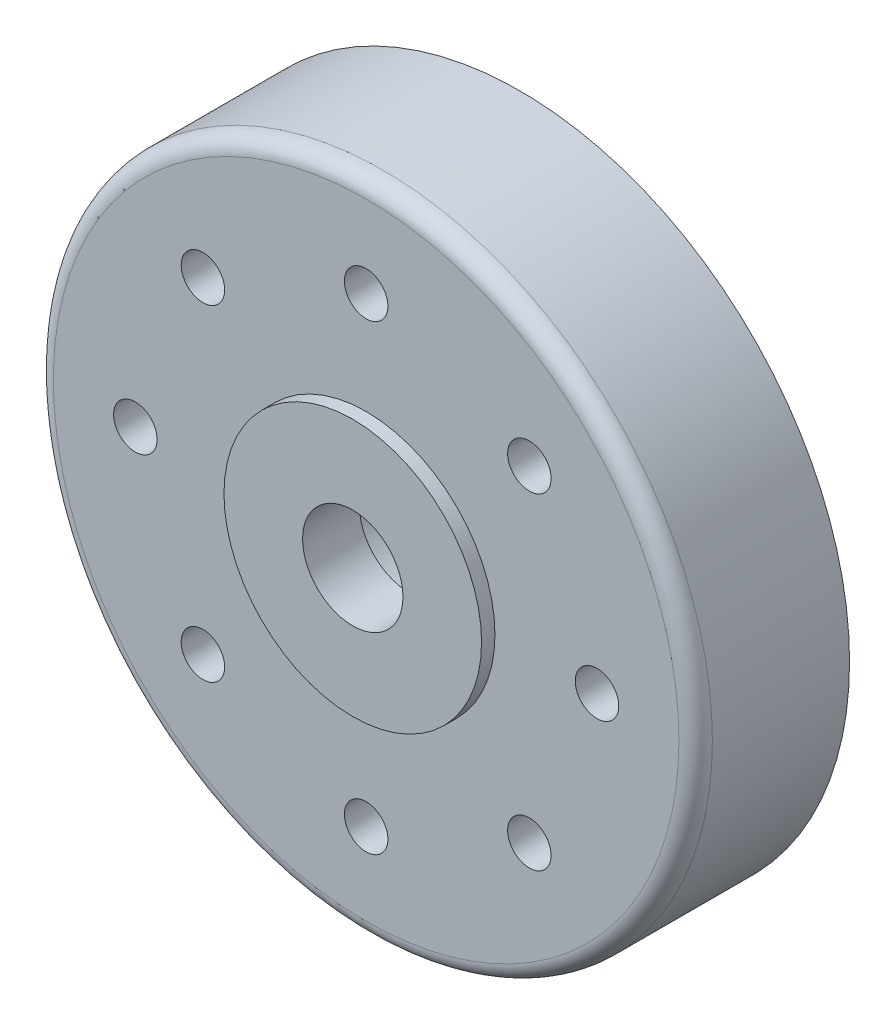
from build123d import *

# Parameters (mm, degrees)
SKETCH1_R           = 9.85
SKETCH1_R_2         = 1.5
SKETCH1_R_3         = 0.65
BOSS_EXTRUDE1_DEPTH = 5
SKETCH4_R           = 2.5
CUT_EXTRUDE2_DEPTH  = 3.3
SHELL1_OUTLINE_R    = 3.9
SHELL1_DEPTH        = 3.6
CUT_EXTRUDE1_START  = -0.4
SKETCH3_R           = 9.85
SKETCH3_R_2         = 3.85
CUT_EXTRUDE1_DEPTH  = 0.4
FILLET1_R           = 0.5


# Read off the part's stored shape, not the designer's step: Shell1
with BuildPart() as part:
    # Sketch1 → Boss-Extrude1 (new body)
    with BuildSketch(Plane.XY):
        Circle(SKETCH1_R)
        Circle(SKETCH1_R_2, mode=Mode.SUBTRACT)
        with Locations((0, 6.9)):
            Circle(SKETCH1_R_3, mode=Mode.SUBTRACT)
        with Locations((4.87903679, 4.87903679)):
            Circle(SKETCH1_R_3, mode=Mode.SUBTRACT)
        with Locations((6.9, 0)):
            Circle(SKETCH1_R_3, mode=Mode.SUBTRACT)
        with Locations((4.87903679, -4.87903679)):
            Circle(SKETCH1_R_3, mode=Mode.SUBTRACT)
        with Locations((0, -6.9)):
            Circle(SKETCH1_R_3, mode=Mode.SUBTRACT)
        with Locations((-4.87903679, -4.87903679)):
            Circle(SKETCH1_R_3, mode=Mode.SUBTRACT)
        with Locations((-6.9, 0)):
            Circle(SKETCH1_R_3, mode=Mode.SUBTRACT)
        with Locations((-4.87903679, 4.87903679)):
            Circle(SKETCH1_R_3, mode=Mode.SUBTRACT)
    extrude(amount=BOSS_EXTRUDE1_DEPTH)

    # Sketch4 → Cut-Extrude2 (cut)
    with BuildSketch(Plane(origin=(0, 0, 0), x_dir=(-1, 0, 0), z_dir=(0, 0, -1))):
        Circle(SKETCH4_R)
    extrude(amount=-CUT_EXTRUDE2_DEPTH, mode=Mode.SUBTRACT)

    # Shell1 outline → Shell1 (cut)
    with BuildSketch(Plane.XY):
        with BuildLine():
            ThreePointArc((4.837035489, 6.928606474), (3.233675004, 7.80678205), (1.478964027, 8.319565217))
            ThreePointArc((1.478964027, 8.319565217), (0, 4.85), (-1.478964027, 8.319565217))
            ThreePointArc((-1.478964027, 8.319565217), (-3.233675004, 7.80678205), (-4.837035489, 6.928606474))
            ThreePointArc((-4.837035489, 6.928606474), (-3.429467889, 3.429467889), (-6.928606474, 4.837035489))
            ThreePointArc((-6.928606474, 4.837035489), (-7.80678205, 3.233675004), (-8.319565217, 1.478964027))
            ThreePointArc((-8.319565217, 1.478964027), (-4.85, 0), (-8.319565217, -1.478964027))
            ThreePointArc((-8.319565217, -1.478964027), (-7.80678205, -3.233675004), (-6.928606474, -4.837035489))
            ThreePointArc((-6.928606474, -4.837035489), (-3.429467889, -3.429467889), (-4.837035489, -6.928606474))
            ThreePointArc((-4.837035489, -6.928606474), (-3.233675004, -7.80678205), (-1.478964027, -8.319565217))
            ThreePointArc((-1.478964027, -8.319565217), (0, -4.85), (1.478964027, -8.319565217))
            ThreePointArc((1.478964027, -8.319565217), (3.233675004, -7.80678205), (4.837035489, -6.928606474))
            ThreePointArc((4.837035489, -6.928606474), (3.429467889, -3.429467889), (6.928606474, -4.837035489))
            ThreePointArc((6.928606474, -4.837035489), (7.80678205, -3.233675004), (8.319565217, -1.478964027))
            ThreePointArc((8.319565217, -1.478964027), (4.85, 0), (8.319565217, 1.478964027))
            ThreePointArc((8.319565217, 1.478964027), (7.80678205, 3.233675004), (6.928606474, 4.837035489))
            ThreePointArc((6.928606474, 4.837035489), (3.429467889, 3.429467889), (4.837035489, 6.928606474))
        make_face()
        Circle(SHELL1_OUTLINE_R, mode=Mode.SUBTRACT)
    extrude(amount=SHELL1_DEPTH, mode=Mode.SUBTRACT)

    # Sketch3 → Cut-Extrude1 (cut)
    with BuildSketch(Plane.XY.offset(5).offset(CUT_EXTRUDE1_START)):
        Circle(SKETCH3_R)
        Circle(SKETCH3_R_2, mode=Mode.SUBTRACT)
    extrude(amount=CUT_EXTRUDE1_DEPTH, mode=Mode.SUBTRACT)

    # Fillet1
    fillet1_edges = [part.edges().sort_by_distance(p)[0] for p in [
        (-9.85, 0, 4.6),
    ]]
    fillet(fillet1_edges, radius=FILLET1_R)


solid = part.part
